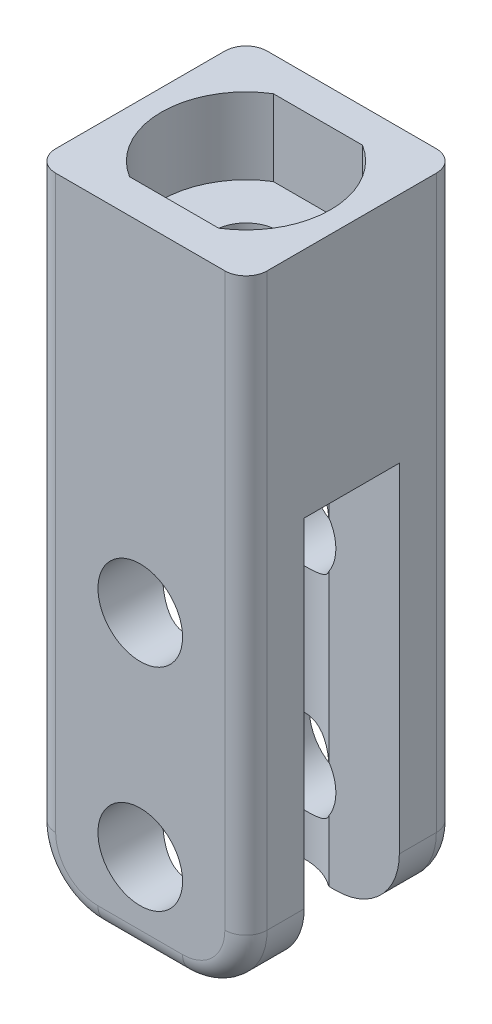
from build123d import *

# Parameters (mm, degrees)
SKETCH2_W               = 10
SKETCH2_H               = 10
BOSS_EXTRUDE3_DEPTH     = 30
SKETCH1_R               = 2
CUT_EXTRUDE1_DEPTH      = 33.015621187
CUT_EXTRUDE2_DEPTH      = 31.822070015
CUT_EXTRUDE2_DEPTH_BACK = 31.822070015
SKETCH3_W               = 4.5
SKETCH3_H               = 19
SKETCH5_R               = 1.5
CUT_EXTRUDE3_DEPTH      = 3.6
SKETCH5_2_R             = 1.5
CUT_EXTRUDE4_DEPTH      = 31.822070015
FILLET3_R               = 3
FILLET1_R               = 1
CUT_EXTRUDE5_DEPTH      = 21.273134957
CUT_EXTRUDE5_DEPTH_BACK = 3.25
SKETCH6_R               = 2.8


with BuildPart() as part:
    # Sketch2 → Boss-Extrude3 (new body)
    with BuildSketch(Plane(origin=(0, 0, 0), x_dir=(1, 0, 0), z_dir=(0, 1, 0))):
        Rectangle(SKETCH2_W, SKETCH2_H)
    extrude(amount=BOSS_EXTRUDE3_DEPTH)

    # Sketch1 → Cut-Extrude1 (cut, through all)
    with BuildSketch(Plane.XY.offset(5)):
        with Locations((0, 4)):
            Circle(SKETCH1_R)
        with Locations((0, 14)):
            Circle(SKETCH1_R)
    extrude(amount=-CUT_EXTRUDE1_DEPTH, mode=Mode.SUBTRACT)

    # Sketch3 → Cut-Extrude2 (cut, two sides: drawn at the far end of the back side and taken through both)
    with BuildSketch(Plane(origin=(0, 0, 0), x_dir=(0, 0, -1), z_dir=(1, 0, 0)).offset(-CUT_EXTRUDE2_DEPTH_BACK)):
        with Locations((0, 9.5)):
            Rectangle(SKETCH3_W, SKETCH3_H)
    extrude(amount=CUT_EXTRUDE2_DEPTH + CUT_EXTRUDE2_DEPTH_BACK, mode=Mode.SUBTRACT)

    # Sketch5 → Cut-Extrude3 (cut)
    with BuildSketch(Plane(origin=(0, 30, 0), x_dir=(1, 0, 0), z_dir=(0, 1, 0))):
        with BuildLine():
            Line((-2.107130751, -3.4), (2.107130751, -3.4))
            ThreePointArc((2.107130751, -3.4), (4, 0), (2.107130751, 3.4))
            Line((2.107130751, 3.4), (-2.107130751, 3.4))
            ThreePointArc((-2.107130751, 3.4), (-4, 0), (-2.107130751, -3.4))
        make_face()
        Circle(SKETCH5_R, mode=Mode.SUBTRACT)
    extrude(amount=-CUT_EXTRUDE3_DEPTH, mode=Mode.SUBTRACT)

    # Sketch5<2> → Cut-Extrude4 (cut, through all)
    with BuildSketch(Plane(origin=(0, 30, 0), x_dir=(1, 0, 0), z_dir=(0, 1, 0))):
        Circle(SKETCH5_2_R)
    extrude(amount=-CUT_EXTRUDE4_DEPTH, mode=Mode.SUBTRACT)

    # Fillet3
    fillet3_edges = [part.edges().sort_by_distance(p)[0] for p in [
        (-5, 0, -3.625),
        (5, 0, -3.625),
        (5, 0, 3.625),
        (-5, 0, 3.625),
    ]]
    fillet(fillet3_edges, radius=FILLET3_R)

    # Fillet1
    fillet1_edges = [part.edges().sort_by_distance(p)[0] for p in [
        (5, 16.5, 5),
        (-5, 16.5, -5),
        (5, 16.5, -5),
        (-5, 16.5, 5),
        (0, 0, -5),
        (0, 0, 5),
        (-4.121320344, 0.878679656, -5),
        (4.121320344, 0.878679656, -5),
        (4.121320344, 0.878679656, 5),
        (-4.121320344, 0.878679656, 5),
    ]]
    fillet(fillet1_edges, radius=FILLET1_R)

    # Sketch6 → Cut-Extrude5 (cut, two sides: drawn at the far end of the back side and taken through both)
    with BuildSketch(Plane.XZ.offset(-19).offset(-CUT_EXTRUDE5_DEPTH_BACK)):
        Circle(SKETCH6_R)
    extrude(amount=CUT_EXTRUDE5_DEPTH + CUT_EXTRUDE5_DEPTH_BACK, mode=Mode.SUBTRACT)


solid = part.part
